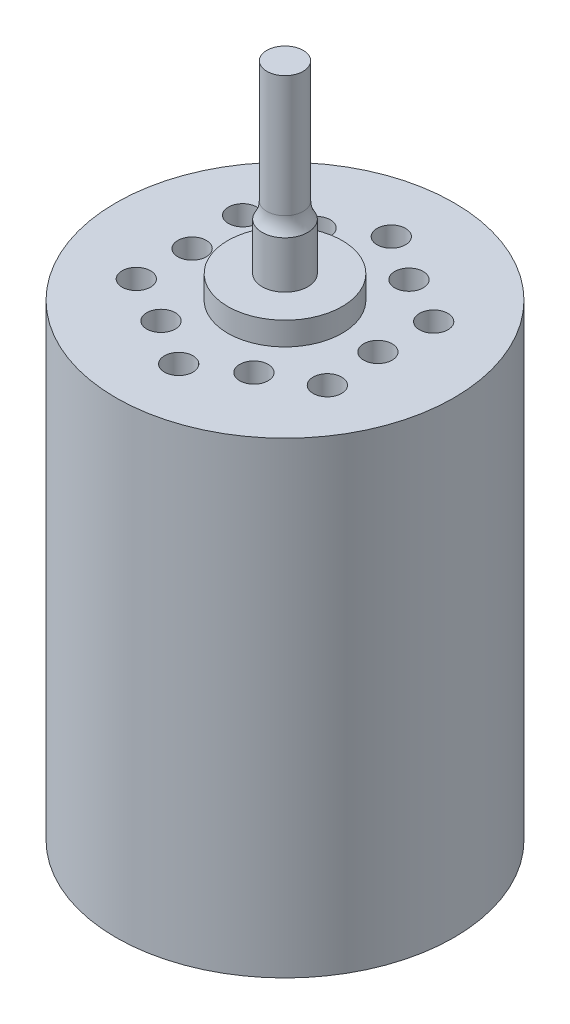
from build123d import *

# Parameters (mm, degrees)
SKETCH1_R           = 14.8209
BOSS_EXTRUDE1_DEPTH = 40.9956
SKETCH2_R           = 5.0165
BOSS_EXTRUDE2_DEPTH = 2.032
SKETCH3_R           = 2.0066
BOSS_EXTRUDE3_DEPTH = 4.1275
SKETCH4_R           = 1.59385
BOSS_EXTRUDE4_DEPTH = 12.0269
FILLET1_R           = 2.54
SKETCH5_R           = 1.25
CUT_EXTRUDE1_DEPTH  = 3.175
SKETCH6_R           = 14.4272
CUT_EXTRUDE2_DEPTH  = 35.56


with BuildPart() as part:
    # Sketch1 → Boss-Extrude1 (new body)
    with BuildSketch(Plane(origin=(0, 0, 0), x_dir=(1, 0, 0), z_dir=(0, 1, 0))):
        with Locations(Location((0, 0, 0), (0, 0, 270))):
            Circle(SKETCH1_R)
    extrude(amount=BOSS_EXTRUDE1_DEPTH)

    # Sketch2 → Boss-Extrude2 (add)
    with BuildSketch(Plane(origin=(0, 40.9956, 0), x_dir=(1, 0, 0), z_dir=(0, 1, 0))):
        with Locations(Location((0, 0, 0), (0, 0, 270))):
            Circle(SKETCH2_R)
    extrude(amount=BOSS_EXTRUDE2_DEPTH)

    # Sketch3 → Boss-Extrude3 (add)
    with BuildSketch(Plane(origin=(0, 43.0276, 0), x_dir=(1, 0, 0), z_dir=(0, 1, 0))):
        with Locations(Location((0, 0, 0), (0, 0, 270))):
            Circle(SKETCH3_R)
    extrude(amount=BOSS_EXTRUDE3_DEPTH)

    # Sketch4 → Boss-Extrude4 (add)
    with BuildSketch(Plane(origin=(0, 47.1551, 0), x_dir=(1, 0, 0), z_dir=(0, 1, 0))):
        with Locations(Location((0, 0, 0), (0, 0, 90))):
            Circle(SKETCH4_R)
    extrude(amount=BOSS_EXTRUDE4_DEPTH)

    # Fillet1
    # the kernel refuses this fillet: 2.54 mm, written as the material it adds along each edge
    with BuildSketch(Plane(origin=(0, 47.1551, 0), x_dir=(0, 0, -1), z_dir=(1, 0, 0))) as fillet1_piece_1:
        with BuildLine():
            CenterArc((4.13385, 1.387950805), FILLET1_R, 180, 33.122940208)
            Line((1.59385, 1.387950805), (1.54305, 1.387950805))
            Line((1.54305, 1.387950805), (1.54305, 0))
            Line((1.54305, 0), (1.59385, -0.0508))
            ThreePointArc((1.59385, -0.0508), (1.800225, -0.0508), (1.964055, -0.027759016))
            Line((1.964055, -0.027759016), (2.0066, 0))
        make_face()
    revolve(axis=Axis((0, 47.1551, 0), (0, 1, 0)))

    # Sketch5 → Cut-Extrude1 (cut)
    with BuildSketch(Plane(origin=(0, 40.9956, 0), x_dir=(1, 0, 0), z_dir=(0, 1, 0))):
        with Locations(Location((-0.175376493, 9.498381077, 0), (0, 0, 270))):
            Circle(SKETCH5_R)
        with Locations(Location((3.871418981, 7.000865309, 0), (0, 0, 270))):
            Circle(SKETCH5_R)
        with Locations(Location((8.138151061, 4.901071037, 0), (0, 0, 270))):
            Circle(SKETCH5_R)
        with Locations(Location((7.998636697, 0.147685468, 0), (0, 0, 270))):
            Circle(SKETCH5_R)
        with Locations(Location((8.313527554, -4.59731004, 0), (0, 0, 270))):
            Circle(SKETCH5_R)
        with Locations(Location((0.175376493, -9.498381077, 0), (0, 0, 270))):
            Circle(SKETCH5_R)
        with Locations(Location((-3.871418981, -7.000865309, 0), (0, 0, 270))):
            Circle(SKETCH5_R)
        with Locations(Location((-8.138151061, -4.901071037, 0), (0, 0, 270))):
            Circle(SKETCH5_R)
        with Locations(Location((-7.998636697, -0.147685468, 0), (0, 0, 270))):
            Circle(SKETCH5_R)
        with Locations(Location((-4.127217715, 6.853179841, 0), (0, 0, 270))):
            Circle(SKETCH5_R)
        with Locations(Location((-8.313527554, 4.59731004, 0), (0, 0, 270))):
            Circle(SKETCH5_R)
        with Locations(Location((4.127217715, -6.853179841, 0), (0, 0, 270))):
            Circle(SKETCH5_R)
    extrude(amount=-CUT_EXTRUDE1_DEPTH, mode=Mode.SUBTRACT)

    # Sketch6 → Cut-Extrude2 (cut)
    with BuildSketch(Plane(origin=(0, 37.8206, 0), x_dir=(1, 0, 0), z_dir=(0, 1, 0))):
        with Locations(Location((0, 0, 0), (0, 0, 270))):
            Circle(SKETCH6_R)
    extrude(amount=-CUT_EXTRUDE2_DEPTH, mode=Mode.SUBTRACT)


solid = part.part
